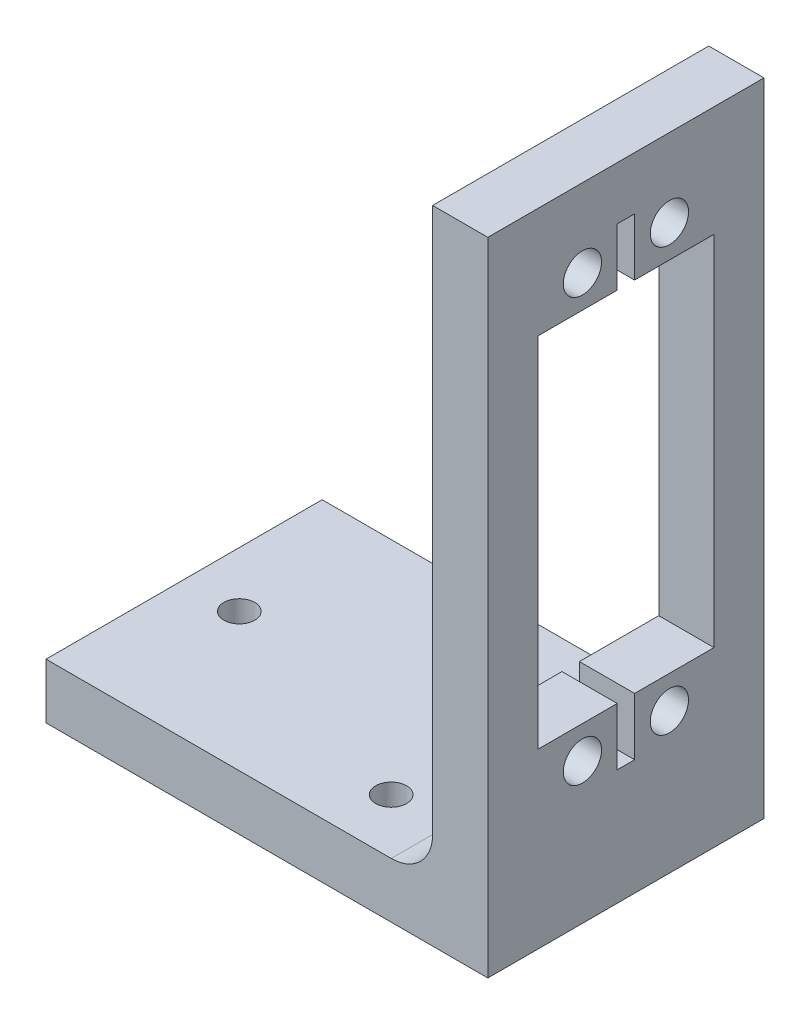
from build123d import *

# Parameters (mm, degrees)
SKETCH3_W           = 31.75
SKETCH3_H           = 67.404000066
SKETCH3_R           = 2.200000045
BOSS_EXTRUDE1_DEPTH = 6.35
SKETCH5_W           = 31.75
SKETCH5_H           = 6.35
BOSS_EXTRUDE2_DEPTH = 50.8
FILLET1_R           = 4.7625
SKETCH6_R           = 1.777000002
CUT_EXTRUDE1_DEPTH  = 87.759231353


with BuildPart() as part:
    # Sketch3 → Boss-Extrude1 (new body)
    with BuildSketch(Plane(origin=(0, 0, 0), x_dir=(0, 0, -1), z_dir=(1, 0, 0))):
        with Locations((15.875, 33.702000033)):
            Rectangle(SKETCH3_W, SKETCH3_H)
        with Locations((10.874999967, 9.827000031)):
            Circle(SKETCH3_R, mode=Mode.SUBTRACT)
        with Locations((20.875000033, 9.827000031)):
            Circle(SKETCH3_R, mode=Mode.SUBTRACT)
        with Locations((10.874999967, 58.427000113)):
            Circle(SKETCH3_R, mode=Mode.SUBTRACT)
        with Locations((20.875000033, 58.427000113)):
            Circle(SKETCH3_R, mode=Mode.SUBTRACT)
        Polygon((5.748000061, 54.704000066), (14.875, 54.704000066), (14.875, 61.308000066), (16.875, 61.308000066), (16.875, 54.704000066), (26.001999939, 54.704000066), (26.001999939, 13.550000078), (16.875, 13.550000078), (16.875, 6.946000078), (14.875, 6.946000078), (14.875, 13.550000078), (5.748000061, 13.550000078), align=None, mode=Mode.SUBTRACT)
    extrude(amount=BOSS_EXTRUDE1_DEPTH)

    # Sketch5 → Boss-Extrude2 (add)
    with BuildSketch(Plane(origin=(6.35, 0, 0), x_dir=(0, 0, -1), z_dir=(1, 0, 0))):
        with Locations((15.875, -3.175)):
            Rectangle(SKETCH5_W, SKETCH5_H)
    extrude(amount=-BOSS_EXTRUDE2_DEPTH)

    # Fillet1
    fillet1_edges = [part.edges().sort_by_distance(p)[0] for p in [
        (0, 0, -15.875),
    ]]
    fillet(fillet1_edges, radius=FILLET1_R)

    # Sketch6 → Cut-Extrude1 (cut, through all)
    with BuildSketch(Plane(origin=(0, 0, 0), x_dir=(1, 0, 0), z_dir=(0, 1, 0))):
        with Locations((-11.1125, 6.35)):
            Circle(SKETCH6_R)
        with Locations((-38.1, 15.875)):
            Circle(SKETCH6_R)
        with Locations((-11.1125, 25.4)):
            Circle(SKETCH6_R)
    extrude(amount=-CUT_EXTRUDE1_DEPTH, mode=Mode.SUBTRACT)


solid = part.part
